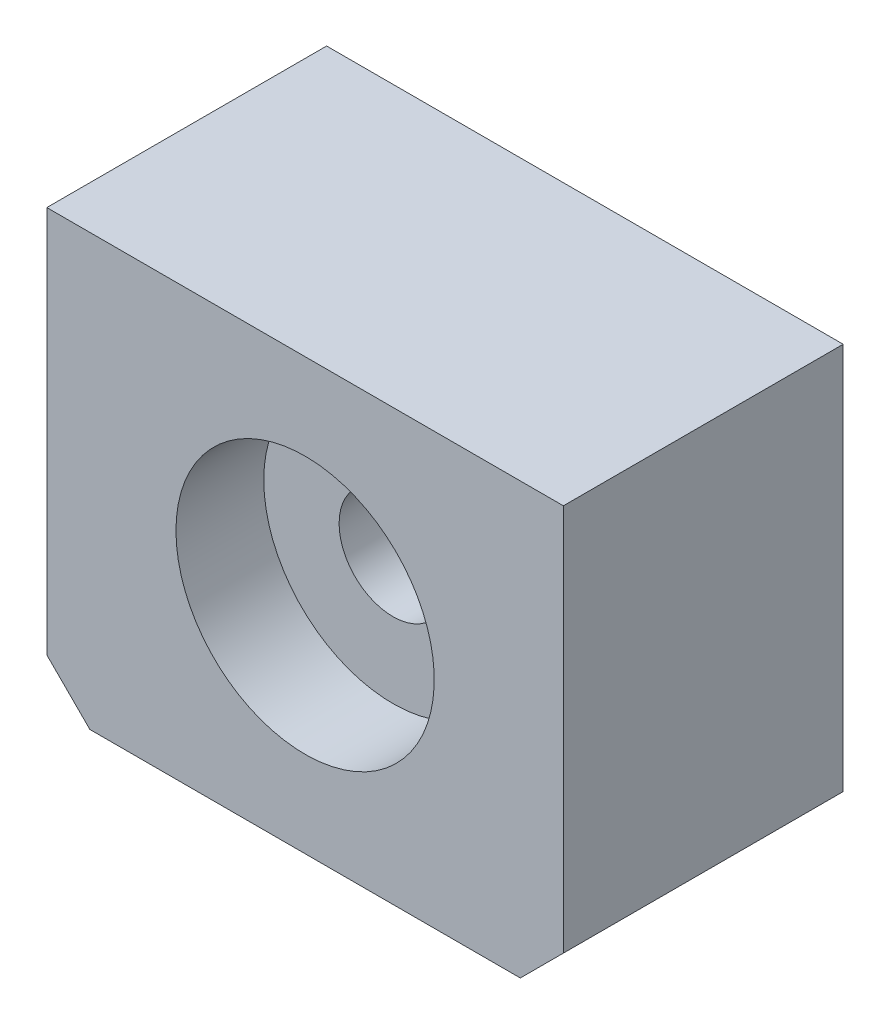
from build123d import *

# Parameters (mm, degrees)
SKETCH1_W                 = 38.1
SKETCH1_H                 = 31.75
BOSS_EXTRUDE1_DEPTH       = 20.6375
SKETCH2_R                 = 11.1125
CUT_EXTRUDE1_DEPTH        = 6.985
SKETCH3_R                 = 8.255
CUT_EXTRUDE2_DEPTH        = 2.413
SKETCH4_R                 = 3.96875
CUT_EXTRUDE3_DEPTH        = 28.225805502
CUT_EXTRUDE4_START        = -4.7625
SKETCH6_R                 = 9.525
CUT_EXTRUDE4_DEPTH        = 23.463305502
CHAMFER1_SIZE             = 3.175
F_4_CLEARANCE_HOLE1_D     = 3.2639
F_4_CLEARANCE_HOLE1_DEPTH = 6.35


with BuildPart() as part:
    # Sketch1 → Boss-Extrude1 (new body)
    with BuildSketch(Plane.XY):
        Rectangle(SKETCH1_W, SKETCH1_H)
    extrude(amount=BOSS_EXTRUDE1_DEPTH)

    # Sketch2 → Cut-Extrude1 (cut)
    with BuildSketch(Plane(origin=(0, 0, 0), x_dir=(-1, 0, 0), z_dir=(0, 0, -1))):
        Circle(SKETCH2_R)
    extrude(amount=-CUT_EXTRUDE1_DEPTH, mode=Mode.SUBTRACT)

    # Sketch3 → Cut-Extrude2 (cut)
    with BuildSketch(Plane(origin=(0, 0, 6.985), x_dir=(-1, 0, 0), z_dir=(0, 0, -1))):
        Circle(SKETCH3_R)
    extrude(amount=-CUT_EXTRUDE2_DEPTH, mode=Mode.SUBTRACT)

    # Sketch4 → Cut-Extrude3 (cut, through all)
    with BuildSketch(Plane(origin=(0, 0, 9.398), x_dir=(-1, 0, 0), z_dir=(0, 0, -1))):
        Circle(SKETCH4_R)
    extrude(amount=-CUT_EXTRUDE3_DEPTH, mode=Mode.SUBTRACT)

    # Sketch6 → Cut-Extrude4 (cut, through all)
    with BuildSketch(Plane(origin=(0, 0, 9.398), x_dir=(-1, 0, 0), z_dir=(0, 0, -1)).offset(CUT_EXTRUDE4_START)):
        Circle(SKETCH6_R)
    extrude(amount=-CUT_EXTRUDE4_DEPTH, mode=Mode.SUBTRACT)

    # Chamfer1
    chamfer1_edges = [part.edges().sort_by_distance(p)[0] for p in [
        (19.05, -15.875, 10.31875),
        (-19.05, -15.875, 10.31875),
    ]]
    chamfer(chamfer1_edges, length=CHAMFER1_SIZE)

    # #4 Clearance Hole1
    with Locations(Plane(origin=(-19.05, -28.277043901, 98.894849861), x_dir=(0, 0, 1), z_dir=(-1, 0, 0))):
        with Locations((-92.544849861, 31.452043901), (-83.019849861, 31.452043901), (-83.019849861, 21.927043901), (-92.544849861, 21.927043901)):
            Hole(F_4_CLEARANCE_HOLE1_D / 2, depth=F_4_CLEARANCE_HOLE1_DEPTH)


solid = part.part
